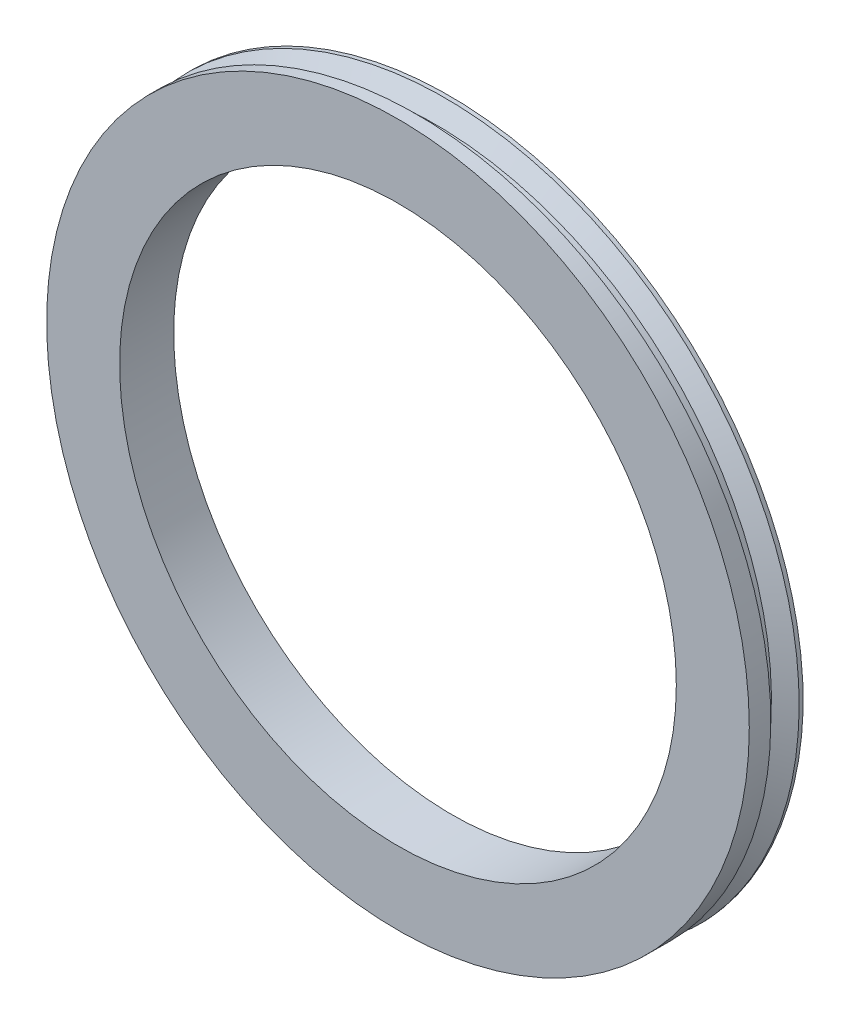
from build123d import *

# Parameters (mm, degrees)
SKETCH1_R           = 65
SKETCH1_R_2         = 51.5
BOSS_EXTRUDE1_DEPTH = 10
THREAD1_PITCH       = 6
SKETCH10_R          = 1
CUT_EXTRUDE1_DEPTH  = 21


with BuildPart() as part:
    # Sketch1 → Boss-Extrude1 (new body)
    with BuildSketch(Plane.XY):
        Circle(SKETCH1_R)
        Circle(SKETCH1_R_2, mode=Mode.SUBTRACT)
    extrude(amount=BOSS_EXTRUDE1_DEPTH)

    # Thread1: the profile of Thread Profile1 profile screwed along a right-hand helix of 1.5 turns, 14 arcs to a turn; built about Z, then put on its axis
    thread1_z = Axis((0, 0, 0), (0, 0, 1))
    thread1_corners = [(65.0003, -1.9e-08, -0.000173205), (65.0003, -1.9e-08, 5.250173189), (61.75240475, -1.8e-08, 3.374999992), (61.75240475, -1.8e-08, 1.874999992)]
    with BuildLine(mode=Mode.PRIVATE) as thread1_profile:
        Line(thread1_corners[0], thread1_corners[1])
        Line(thread1_corners[1], thread1_corners[2])
        Line(thread1_corners[2], thread1_corners[3])
        Line(thread1_corners[3], thread1_corners[0])
    thread1_cap = Face(thread1_profile.wire())
    thread1_turn_angles = [0, 12.857142857, 25.714285714, 38.571428571, 51.428571429, 64.285714286, 77.142857143, 90, 102.857142857, 115.714285714, 128.571428571, 141.428571429, 154.285714286, 167.142857143, 180, 192.857142857, 205.714285714, 218.571428571, 231.428571429, 244.285714286, 257.142857143, 270, 282.857142857, 295.714285714, 308.571428571, 321.428571429, 334.285714286, 347.142857143, 360]
    thread1_turn_weights = [1, 0.9749279121818236, 1, 0.9749279121818236, 1, 0.9749279121818236, 1, 0.9749279121818236, 1, 0.9749279121818236, 1, 0.9749279121818236, 1, 0.9749279121818236, 1, 0.9749279121818236, 1, 0.9749279121818236, 1, 0.9749279121818236, 1, 0.9749279121818236, 1, 0.9749279121818237, 1, 0.9749279121818236, 1, 0.9749279121818236, 1]
    thread1_turn_rails = [Edge.make_bspline([Vector(p[0], p[1], 0).rotate(thread1_z, thread1_turn_angles[k]) / thread1_turn_weights[k] + Vector(0, 0, p[2] + THREAD1_PITCH * thread1_turn_angles[k] / 360) for k in range(29)], [0, 0, 0, 1, 1, 2, 2, 3, 3, 4, 4, 5, 5, 6, 6, 7, 7, 8, 8, 9, 9, 10, 10, 11, 11, 12, 12, 13, 13, 14, 14, 14], 2, thread1_turn_weights) for p in thread1_corners]
    thread1_turn_sides = [Face.make_surface_from_curves(thread1_turn_rails[p[0]], thread1_turn_rails[p[1]]) for p in [(0, 1), (1, 2), (2, 3), (3, 0)]]
    thread1_last_angles = [360, 372.857142857, 385.714285714, 398.571428571, 411.428571429, 424.285714286, 437.142857143, 450, 462.857142857, 475.714285714, 488.571428571, 501.428571429, 514.285714286, 527.142857143, 540]
    thread1_last_weights = [1, 0.9749279121818236, 1, 0.9749279121818236, 1, 0.9749279121818237, 1, 0.9749279121818235, 1, 0.9749279121818237, 1, 0.9749279121818237, 1, 0.9749279121818235, 1]
    thread1_last_rails = [Edge.make_bspline([Vector(p[0], p[1], 0).rotate(thread1_z, thread1_last_angles[k]) / thread1_last_weights[k] + Vector(0, 0, p[2] + THREAD1_PITCH * thread1_last_angles[k] / 360) for k in range(15)], [0, 0, 0, 1, 1, 2, 2, 3, 3, 4, 4, 5, 5, 6, 6, 7, 7, 7], 2, thread1_last_weights) for p in thread1_corners]
    thread1_last_sides = [Face.make_surface_from_curves(thread1_last_rails[p[0]], thread1_last_rails[p[1]]) for p in [(0, 1), (1, 2), (2, 3), (3, 0)]]
    thread1 = Plane(origin=(0, 0, 9), x_dir=(-0.999390827, 0.034899497, 0), z_dir=(0, 0, -1)) * Solid(Shell([*thread1_turn_sides, *thread1_last_sides, thread1_cap, thread1_cap.rotate(thread1_z, 540).moved(Location((0, 0, THREAD1_PITCH * 540 / 360)))]))
    add(thread1, mode=Mode.SUBTRACT)

    # Sketch10 → Cut-Extrude1 (cut)
    with BuildSketch(Plane(origin=(0, 0, 0), x_dir=(0.9993908270190958, -0.03489949670250096, 0), z_dir=(0.03489949670250096, 0.9993908270190958, 0))):
        with Locations(Location((-63.387356221, -6.373965218, 0), (0, 0, 180))):
            Circle(SKETCH10_R)
    extrude(amount=-CUT_EXTRUDE1_DEPTH, mode=Mode.SUBTRACT)


solid = part.part
